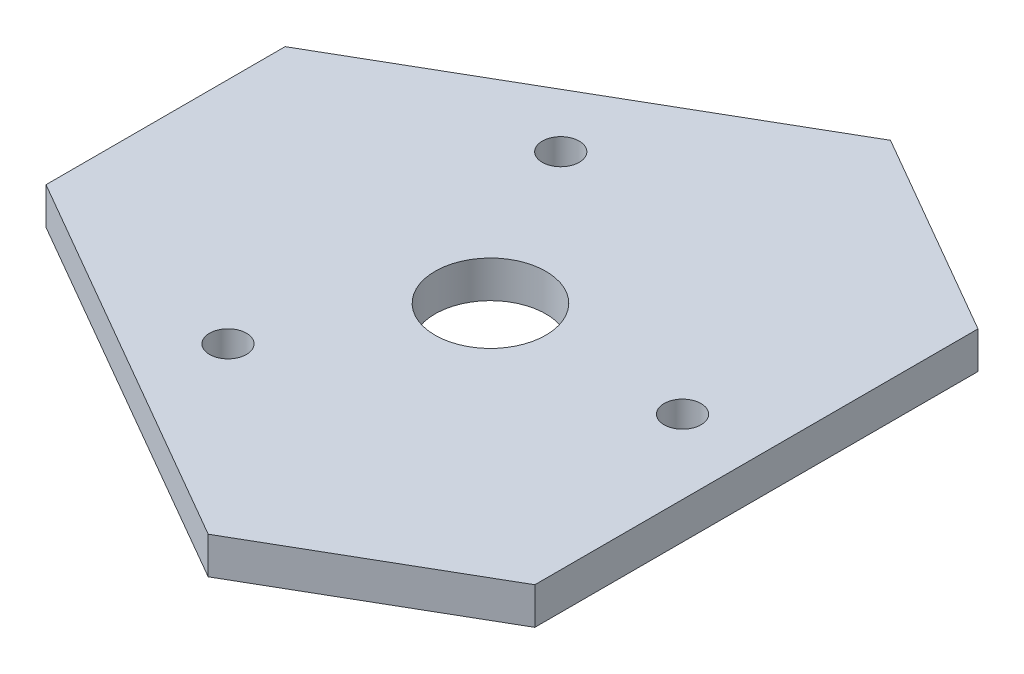
from build123d import *

# Parameters (mm, degrees)
SKETCH2_R           = 1.5875
SKETCH2_R_2         = 4.7625
BOSS_EXTRUDE2_DEPTH = 3.175


with BuildPart() as part:
    # Sketch2 → Boss-Extrude2 (new body)
    with BuildSketch(Plane(origin=(0, 0, 0), x_dir=(1, 0, 0), z_dir=(0, 1, 0))):
        Polygon((22.868144039, 19.05), (22.868144039, -19.05), (5.063711923, -29.329393675), (-27.931855961, -10.279393675), (-27.931855961, 10.279393675), (5.063711923, 29.329393675), align=None)
        with Locations((16.518144039, 0)):
            Circle(SKETCH2_R, mode=Mode.SUBTRACT)
        with Locations((-8.259072019, -14.305132361)):
            Circle(SKETCH2_R, mode=Mode.SUBTRACT)
        with Locations((-8.259072019, 14.305132361)):
            Circle(SKETCH2_R, mode=Mode.SUBTRACT)
        Circle(SKETCH2_R_2, mode=Mode.SUBTRACT)
    extrude(amount=BOSS_EXTRUDE2_DEPTH)


solid = part.part
